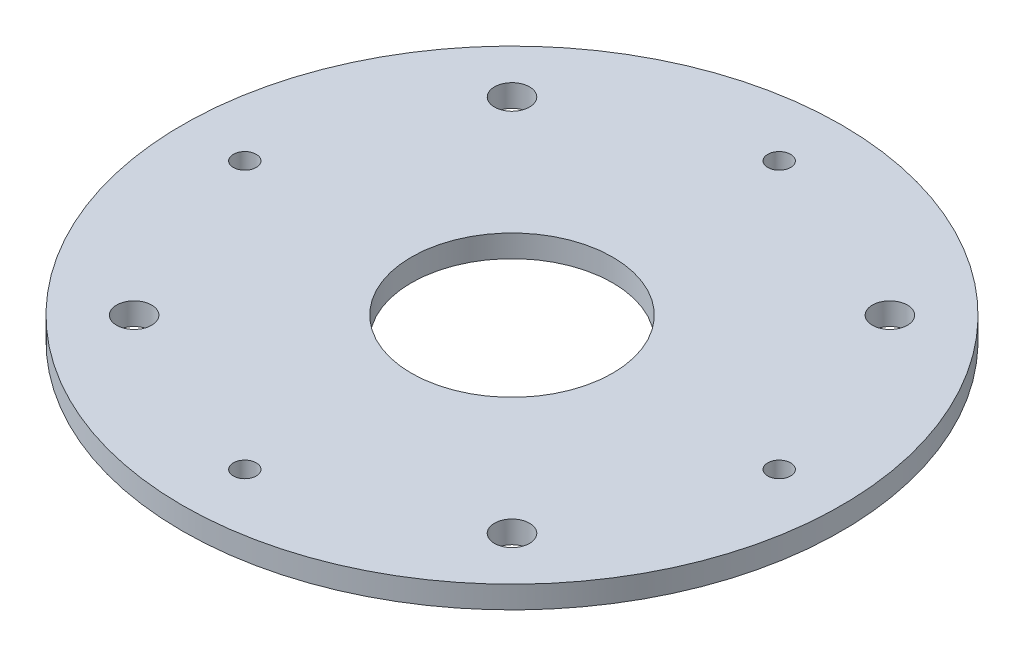
from build123d import *

# Parameters (mm, degrees)
SKETCH1_R           = 46.99
BOSS_EXTRUDE1_DEPTH = 3.175
SKETCH2_R           = 14.351
CUT_EXTRUDE1_DEPTH  = 3.175
CIRPATTERN1_COUNT   = 4
CUT_EXTRUDE2_DEPTH  = 5.08
CIRPATTERN2_COUNT   = 4


with BuildPart() as part:
    # Sketch1 → Boss-Extrude1 (new body)
    with BuildSketch(Plane(origin=(0, 0, 0), x_dir=(1, 0, 0), z_dir=(0, 1, 0))):
        Circle(SKETCH1_R)
    extrude(amount=BOSS_EXTRUDE1_DEPTH)

    # Sketch2 → Cut-Extrude1 (cut)
    with BuildSketch(Plane(origin=(0, 3.175, 0), x_dir=(1, 0, 0), z_dir=(0, 1, 0))):
        Circle(SKETCH2_R)
    extrude(amount=-CUT_EXTRUDE1_DEPTH, mode=Mode.SUBTRACT)

    # Sketch3 → #4 Clearance Hole1 (revolve, cut)
    with BuildSketch(Plane(origin=(0, 3.175, -38.1), x_dir=(0, 0, 1), z_dir=(1, 0, 0))):
        Polygon((0, 0), (0, 11.140574487), (1.63195, 10.16), (1.63195, 0), align=None)
    f_4_clearance_hole1 = revolve(axis=Axis((0, 9.525, -38.1), (0, -1, 0)), mode=Mode.SUBTRACT)

    # CirPattern1: #4 Clearance Hole1 ×4 about axis
    cirpattern1_axis = Axis((0, 3.175, 0), (0, 1, 0))
    for i in range(1, CIRPATTERN1_COUNT):
        add(f_4_clearance_hole1.rotate(cirpattern1_axis, i * 360 / CIRPATTERN1_COUNT), mode=Mode.SUBTRACT)

    # Sketch5 → Cut-Extrude2 (cut)
    with BuildSketch(Plane(origin=(0, 3.175, 0), x_dir=(1, 0, 0), z_dir=(0, 1, 0))):
        with BuildLine():
            ThreePointArc((-25.17300141, 25.17300141), (-24.631069532, 25.984059782), (-24.440768363, 26.940768363))
            ThreePointArc((-24.440768363, 26.940768363), (-29.250467194, 27.897476944), (-25.17300141, 25.17300141))
        make_face()
    cut_extrude2 = extrude(amount=-CUT_EXTRUDE2_DEPTH, mode=Mode.SUBTRACT)

    # CirPattern2: Cut-Extrude2 ×4 about axis
    cirpattern2_axis = Axis((0, 3.175, 0), (0, 1, 0))
    for i in range(1, CIRPATTERN2_COUNT):
        add(cut_extrude2.rotate(cirpattern2_axis, i * 360 / CIRPATTERN2_COUNT), mode=Mode.SUBTRACT)


solid = part.part
